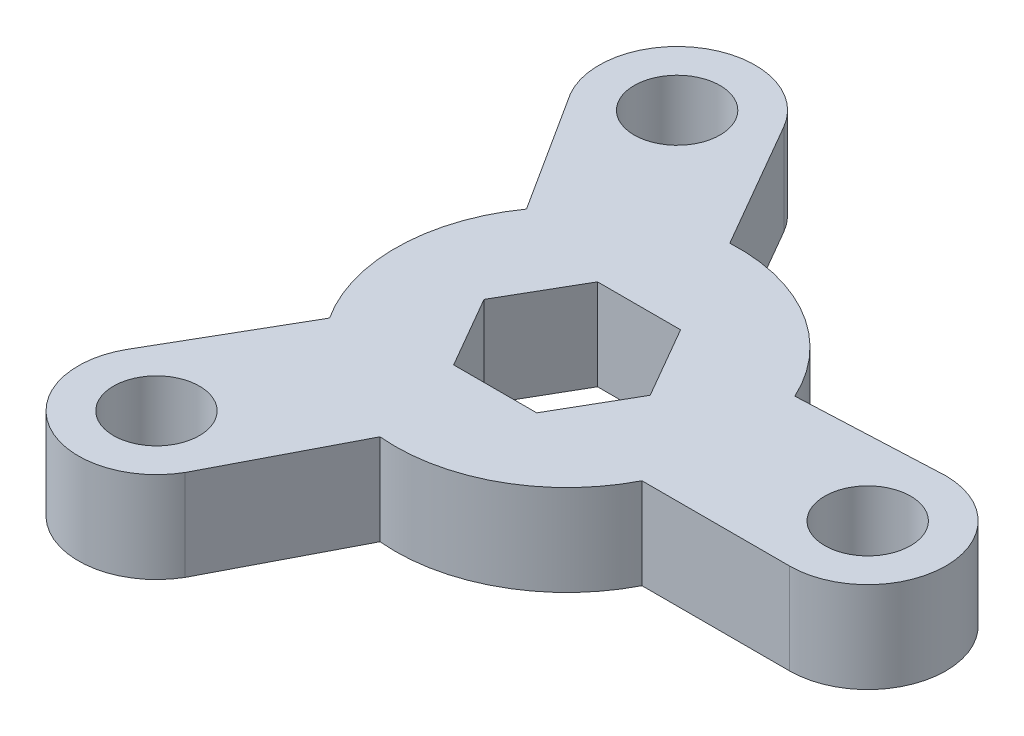
from build123d import *

# Parameters (mm, degrees)
SKETCH1_R           = 1.5
BOSS_EXTRUDE1_DEPTH = 3.175


with BuildPart() as part:
    # Sketch1 → Boss-Extrude1 (new body)
    with BuildSketch(Plane(origin=(0, 0, 0), x_dir=(1, 0, 0), z_dir=(0, 1, 0))):
        with BuildLine():
            ThreePointArc((7.969118099, 2.744709812), (5.624188125, 5.376129638), (2.206241257, 6.236772472))
            Line((2.206241257, 6.236772472), (-0.371989304, 10.702398798))
            ThreePointArc((-0.371989304, 10.702398798), (-4.099660205, 11.701225206), (-5.098486612, 7.973554305))
            Line((-5.098486612, 7.973554305), (-2.377479496, 3.718320719))
            ThreePointArc((-2.377479496, 3.718320719), (-3.483890927, 0.371841879), (-2.520256051, -3.018508355))
            Line((-2.520256051, -3.018508355), (-5.098486612, -7.484134681))
            ThreePointArc((-5.098486612, -7.484134681), (-4.099660205, -11.211805582), (-0.371989304, -10.212979174))
            Line((-0.371989304, -10.212979174), (1.952647522, -5.728901095))
            ThreePointArc((1.952647522, -5.728901095), (5.403988927, -5.013842081), (7.858300919, -2.484134681))
            Line((7.858300919, -2.484134681), (13.014762042, -2.484134681))
            ThreePointArc((13.014762042, -2.484134681), (15.743606535, 0.244709812), (13.014762042, 2.973554305))
            Line((13.014762042, 2.973554305), (7.969118099, 2.744709812))
        make_face()
        Polygon((3.965354593, 2.757209812), (5.415947144, 0.244709812), (3.965354593, -2.267790188), (1.06416949, -2.267790188), (-0.386423061, 0.244709812), (1.06416949, 2.757209812), align=None, mode=Mode.SUBTRACT)
        with Locations((-2.735237958, 9.337976552)):
            Circle(SKETCH1_R, mode=Mode.SUBTRACT)
        with Locations((13.014762042, 0.244709812)):
            Circle(SKETCH1_R, mode=Mode.SUBTRACT)
        with Locations((-2.735237958, -8.848556928)):
            Circle(SKETCH1_R, mode=Mode.SUBTRACT)
    extrude(amount=BOSS_EXTRUDE1_DEPTH)


solid = part.part
